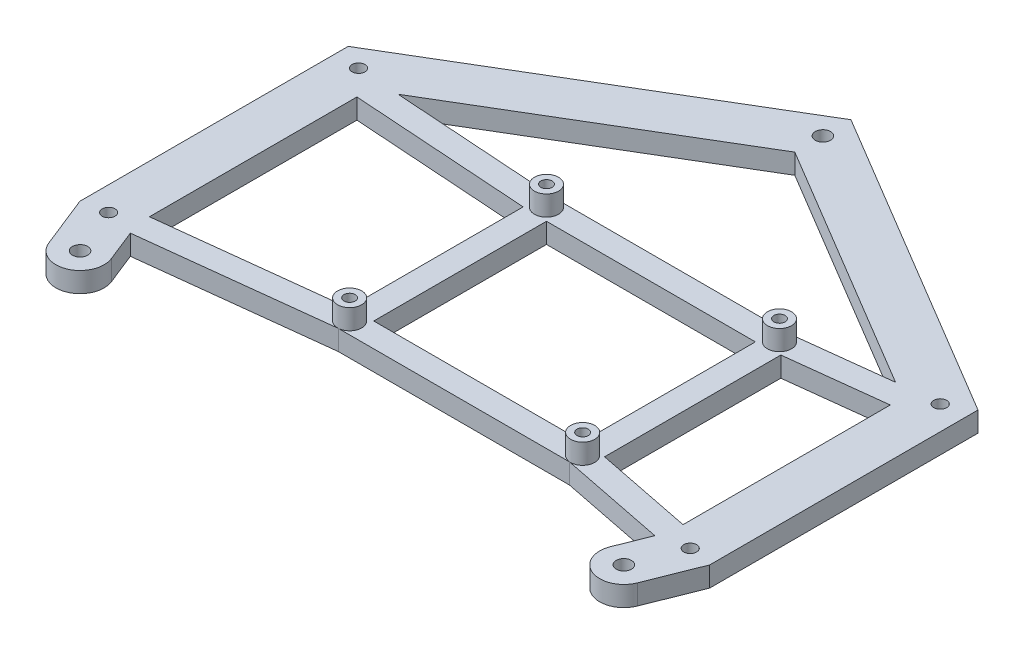
from build123d import *

# Parameters (mm, degrees)
SKETCH2_R             = 1.9
SKETCH2_R_2           = 1.6
BOSS_EXTRUDE1_DEPTH   = 5
SKETCH3_R             = 3
SKETCH3_R_2           = 1.4
BOSS_EXTRUDE2_DEPTH   = 10
BOSS_EXTRUDE2_2_DEPTH = 10
BOSS_EXTRUDE2_3_DEPTH = 10
BOSS_EXTRUDE2_4_DEPTH = 10
SKETCH4_R             = 1.4
BOSS_EXTRUDE3_DEPTH   = 5
SKETCH6_W             = 64
SKETCH6_H             = 55
SKETCH6_R             = 1.4
SKETCH6_W_2           = 52
SKETCH6_H_2           = 43
BOSS_EXTRUDE4_DEPTH   = 5


with BuildPart() as part:
    # Sketch2 → Boss-Extrude1 (new body)
    with BuildSketch(Plane(origin=(0, 0, 0), x_dir=(1, 0, 0), z_dir=(0, 1, 0))):
        with BuildLine():
            Line((-62.106768559, -40.702305751), (-66.39, -29.962659988))
            Line((-66.39, -29.962659988), (-66.39, 27.707815374))
            Line((-66.39, 27.707815374), (0, 67.313453584))
            Line((0, 67.313453584), (66.39, 27.707815374))
            Line((66.39, 27.707815374), (66.39, -29.962659988))
            Line((66.39, -29.962659988), (62.106768559, -40.702305751))
            ThreePointArc((62.106768559, -40.702305751), (65.457191057, -48.498116747), (73.253002053, -45.147694249))
            Line((73.253002053, -45.147694249), (78.39, -32.267340012))
            Line((78.39, -32.267340012), (78.39, 34.522184626))
            Line((78.39, 34.522184626), (0, 81.286546416))
            Line((0, 81.286546416), (-78.39, 34.522184626))
            Line((-78.39, 34.522184626), (-78.39, -32.267340012))
            Line((-78.39, -32.267340012), (-73.253002053, -45.147694249))
            ThreePointArc((-73.253002053, -45.147694249), (-65.457191057, -48.498116747), (-62.106768559, -40.702305751))
        make_face()
        with Locations((-67.679885306, -42.925)):
            Circle(SKETCH2_R, mode=Mode.SUBTRACT)
        with Locations((-72.39, 31.115)):
            Circle(SKETCH2_R_2, mode=Mode.SUBTRACT)
        with Locations((0, 74.3)):
            Circle(SKETCH2_R, mode=Mode.SUBTRACT)
        with Locations((72.39, 31.115)):
            Circle(SKETCH2_R_2, mode=Mode.SUBTRACT)
        with Locations((-72.39, -31.115)):
            Circle(SKETCH2_R_2, mode=Mode.SUBTRACT)
        with Locations((72.39, -31.115)):
            Circle(SKETCH2_R_2, mode=Mode.SUBTRACT)
        with Locations((67.679885306, -42.925)):
            Circle(SKETCH2_R, mode=Mode.SUBTRACT)
    extrude(amount=BOSS_EXTRUDE1_DEPTH)



with BuildPart() as body_2:
    # Sketch3 → Boss-Extrude2 (new body)
    with BuildSketch(Plane(origin=(0, 0, 0), x_dir=(1, 0, 0), z_dir=(0, 1, 0))):
        with Locations((-19, 24.5)):
            Circle(SKETCH3_R)
        with Locations((-19, 24.5)):
            Circle(SKETCH3_R_2, mode=Mode.SUBTRACT)
    extrude(amount=BOSS_EXTRUDE2_DEPTH)


with BuildPart() as body_3:
    # Sketch3 → Boss-Extrude2 2 (new body)
    with BuildSketch(Plane(origin=(0, 0, 0), x_dir=(1, 0, 0), z_dir=(0, 1, 0))):
        with Locations((39, 24.5)):
            Circle(SKETCH3_R)
        with Locations((39, 24.5)):
            Circle(SKETCH3_R_2, mode=Mode.SUBTRACT)
    extrude(amount=BOSS_EXTRUDE2_2_DEPTH)


with BuildPart() as body_4:
    # Sketch3 → Boss-Extrude2 3 (new body)
    with BuildSketch(Plane(origin=(0, 0, 0), x_dir=(1, 0, 0), z_dir=(0, 1, 0))):
        with Locations((39, -24.5)):
            Circle(SKETCH3_R)
        with Locations((39, -24.5)):
            Circle(SKETCH3_R_2, mode=Mode.SUBTRACT)
    extrude(amount=BOSS_EXTRUDE2_3_DEPTH)


with BuildPart() as body_5:
    # Sketch3 → Boss-Extrude2 4 (new body)
    with BuildSketch(Plane(origin=(0, 0, 0), x_dir=(1, 0, 0), z_dir=(0, 1, 0))):
        with Locations((-19, -24.5)):
            Circle(SKETCH3_R)
        with Locations((-19, -24.5)):
            Circle(SKETCH3_R_2, mode=Mode.SUBTRACT)
    extrude(amount=BOSS_EXTRUDE2_4_DEPTH)


with BuildPart() as part_1:
    add(part.part)

    add(body_2.part)  # Boss-Extrude3 merges body 2

    add(body_3.part)  # Boss-Extrude3 merges body 3

    add(body_4.part)  # Boss-Extrude3 merges body 4

    add(body_5.part)  # Boss-Extrude3 merges body 5
    # Sketch4 → Boss-Extrude3 (add)
    # profile 1 of 4: a face of its own
    with BuildSketch(Plane(origin=(0, 0, 0), x_dir=(1, 0, 0), z_dir=(0, 1, 0))):
        with BuildLine():
            Line((-18.797394497, 27.493150683), (-66.187394497, 30.700966057))
            ThreePointArc((-66.187394497, 30.700966057), (-69.383150683, 27.910420877), (-66.592605503, 24.714664691))
            Line((-66.592605503, 24.714664691), (-19.202605503, 21.506849317))
            ThreePointArc((-19.202605503, 21.506849317), (-16.006849317, 24.297394497), (-18.797394497, 27.493150683))
        make_face()
        with Locations((-19, 24.5)):
            Circle(SKETCH4_R, mode=Mode.SUBTRACT)
    # profile 2 of 4: a face of its own
    with BuildSketch(Plane(origin=(0, 0, 0), x_dir=(1, 0, 0), z_dir=(0, 1, 0))):
        with BuildLine():
            Line((-19.343536137, -21.519734421), (-66.733536137, -26.982394408))
            ThreePointArc((-66.733536137, -26.982394408), (-69.370265579, -30.306196125), (-66.046463863, -32.942925567))
            Line((-66.046463863, -32.942925567), (-18.656463863, -27.480265579))
            ThreePointArc((-18.656463863, -27.480265579), (-16.019734421, -24.156463863), (-19.343536137, -21.519734421))
        make_face()
        with Locations((-19, -24.5)):
            Circle(SKETCH4_R, mode=Mode.SUBTRACT)
    # profile 3 of 4: a face of its own
    with BuildSketch(Plane(origin=(0, 0, 0), x_dir=(1, 0, 0), z_dir=(0, 1, 0))):
        with BuildLine():
            Line((39.348963808, 21.520365079), (66.738963808, 24.728180453))
            ThreePointArc((66.738963808, 24.728180453), (69.369634921, 28.056779182), (66.041036192, 30.687450295))
            Line((66.041036192, 30.687450295), (38.651036192, 27.479634921))
            ThreePointArc((38.651036192, 27.479634921), (36.020365079, 24.151036192), (39.348963808, 21.520365079))
        make_face()
        with Locations((39, 24.5)):
            Circle(SKETCH4_R, mode=Mode.SUBTRACT)
    # profile 4 of 4: a face of its own
    with BuildSketch(Plane(origin=(0, 0, 0), x_dir=(1, 0, 0), z_dir=(0, 1, 0))):
        with BuildLine():
            Line((38.413236032, -27.442058471), (65.803236032, -32.904718458))
            ThreePointArc((65.803236032, -32.904718458), (69.332058471, -30.549423956), (66.976763968, -27.020601517))
            Line((66.976763968, -27.020601517), (39.586763968, -21.557941529))
            ThreePointArc((39.586763968, -21.557941529), (36.057941529, -23.913236032), (38.413236032, -27.442058471))
        make_face()
        with Locations((39, -24.5)):
            Circle(SKETCH4_R, mode=Mode.SUBTRACT)
    extrude(amount=BOSS_EXTRUDE3_DEPTH)

    # Sketch6 → Boss-Extrude4 (add)
    with BuildSketch(Plane(origin=(0, 0, 0), x_dir=(1, 0, 0), z_dir=(0, 1, 0))):
        with Locations((10, 0)):
            Rectangle(SKETCH6_W, SKETCH6_H)
        with Locations((39, -24.5)):
            Circle(SKETCH6_R, mode=Mode.SUBTRACT)
        with Locations((39, 24.5)):
            Circle(SKETCH6_R, mode=Mode.SUBTRACT)
        with Locations((-19, 24.5)):
            Circle(SKETCH6_R, mode=Mode.SUBTRACT)
        with Locations((-19, -24.5)):
            Circle(SKETCH6_R, mode=Mode.SUBTRACT)
        with Locations((10, 0)):
            Rectangle(SKETCH6_W_2, SKETCH6_H_2, mode=Mode.SUBTRACT)
    extrude(amount=BOSS_EXTRUDE4_DEPTH)


solid = part_1.part
